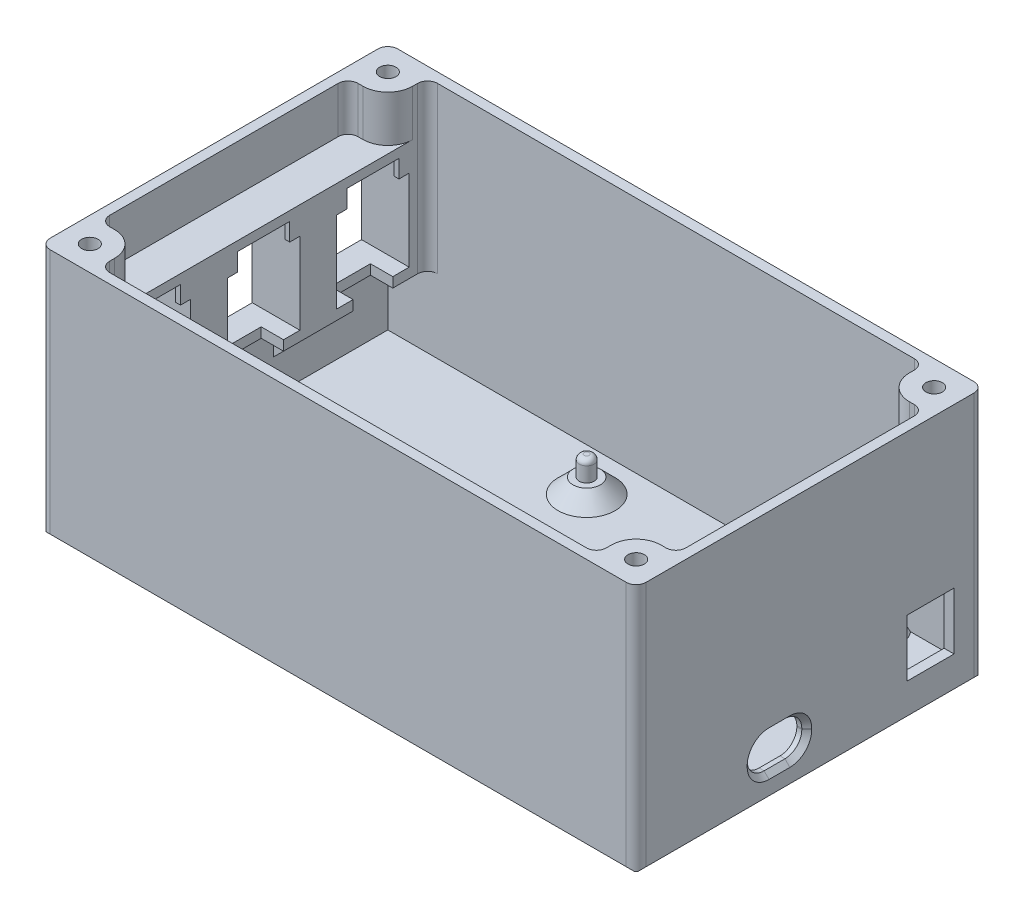
from build123d import *

# Parameters (mm, degrees)
SKETCH1_W                                  = 120
SKETCH1_H                                  = 70
BOSS_EXTRUDE1_DEPTH                        = 50
SHELL1_T                                   = -2
SKETCH16_W                                 = 9.5
SKETCH16_H                                 = 11.5
CUT_EXTRUDE9_DEPTH                         = 2
CHAMFER2_SIZE                              = 1
CHAMFER3_SIZE                              = 0.4
SKETCH17_R                                 = 2.75
BOSS_EXTRUDE7_DEPTH                        = 3
SKETCH18_R                                 = 1.5
BOSS_EXTRUDE8_DEPTH                        = 4
CHAMFER4_SIZE                              = 3
FILLET1_R                                  = 1
CUT_EXTRUDE1_REACH                         = 134.758
SKETCH5_2_W                                = 14.6
SKETCH5_2_H                                = 16.4
CUT_EXTRUDE1_DIRECTION_2_DEPTH             = 10
SKETCH6_W                                  = 18.6
SKETCH6_H                                  = 23.9
BOSS_EXTRUDE5_DEPTH                        = 8
CUT_EXTRUDE2_REACH                         = 134.758
SKETCH5_2_2_W                              = 14.6
SKETCH5_2_2_H                              = 16.4
SKETCH12_W                                 = 14.6
SKETCH12_H                                 = 4.5
CUT_EXTRUDE7_DEPTH                         = 4.5
BOSS_EXTRUDE6_DEPTH                        = 1
CHAMFER1_SIZE                              = 0.4
SKETCH14_W                                 = 8
SKETCH14_H                                 = 2
CUT_EXTRUDE8_DEPTH                         = 4.5
LPATTERN3_COUNT                            = 3
LPATTERN3_PITCH                            = 22
CHAMFER1_OF_LPATTERN3_SIZE                 = 0.4
SKETCH19_W                                 = 66
SKETCH19_H                                 = 12
CUT_EXTRUDE10_DEPTH                        = 0.4
SKETCH20_R                                 = 1.65
BOSS_EXTRUDE9_DEPTH                        = 9.3
MIRROR1_AT_THE_SECOND_PLANE_COPY_1_SKETC_R = 1.65
MIRROR1_AT_THE_SECOND_PLANE_COPY_1_DEPTH   = 9.3
SKETCH21_W                                 = 8
SKETCH21_H                                 = 23.9
BOSS_EXTRUDE10_DEPTH                       = 3.4
SKETCH22_W                                 = 8
SKETCH22_H                                 = 23.9
BOSS_EXTRUDE11_DEPTH                       = 3.4
BOSS_EXTRUDE12_REACH                       = 104.448
SKETCH23_W                                 = 8
SKETCH23_H                                 = 23.9
BOSS_EXTRUDE13_REACH                       = 104.448
SKETCH24_W                                 = 8
SKETCH24_H                                 = 23.9
RIB1_REACH                                 = 92.642
SKETCH25_WALL_W                            = 11.313708498
SKETCH25_WALL_H                            = 2
FILLET2_R                                  = 2


with BuildPart() as part:
    # Sketch1 → Boss-Extrude1 (new body)
    with BuildSketch(Plane(origin=(0, 0, 0), x_dir=(1, 0, 0), z_dir=(0, 1, 0))):
        Rectangle(SKETCH1_W, SKETCH1_H)
    extrude(amount=BOSS_EXTRUDE1_DEPTH)

    # Shell1
    shell1_openings = [part.faces().sort_by_distance(p)[0] for p in [
        (0, 50, 0),
    ]]
    offset(amount=SHELL1_T, openings=shell1_openings, kind=Kind.INTERSECTION)

    # Sketch16 → Cut-Extrude9 (cut)
    with BuildSketch(Plane(origin=(60, 0, 0), x_dir=(0, 0, -1), z_dir=(1, 0, 0))):
        with Locations((24.25, 12.25)):
            Rectangle(SKETCH16_W, SKETCH16_H)
        with BuildLine():
            Line((-8.25, 11.25), (-4.05, 11.25))
            ThreePointArc((-4.05, 11.25), (-1.645836944, 10.254163056), (-0.65, 7.85))
            Line((-0.65, 7.85), (-0.65, 7.65))
            ThreePointArc((-0.65, 7.65), (-1.645836944, 5.245836944), (-4.05, 4.25))
            Line((-4.05, 4.25), (-8.25, 4.25))
            ThreePointArc((-8.25, 4.25), (-10.654163056, 5.245836944), (-11.65, 7.65))
            Line((-11.65, 7.65), (-11.65, 7.85))
            ThreePointArc((-11.65, 7.85), (-10.654163056, 10.254163056), (-8.25, 11.25))
        make_face()
    extrude(amount=-CUT_EXTRUDE9_DEPTH, mode=Mode.SUBTRACT)

    # Chamfer2
    chamfer2_edges = [part.edges().sort_by_distance(p)[0] for p in [
        (60, 10.254163056, 1.645836944),
        (60, 11.25, 6.15),
        (60, 10.254163056, 10.654163056),
        (60, 7.75, 11.65),
        (60, 5.245836944, 10.654163056),
        (60, 4.25, 6.15),
        (60, 5.245836944, 1.645836944),
        (60, 7.75, 0.65),
    ]]
    chamfer(chamfer2_edges, length=CHAMFER2_SIZE)

    # Chamfer3
    chamfer3_edges = [part.edges().sort_by_distance(p)[0] for p in [
        (0, 0, 35),
        (-60, 0, 0),
        (0, 0, -35),
        (60, 0, 0),
    ]]
    chamfer(chamfer3_edges, length=CHAMFER3_SIZE)

    # Sketch17 → Boss-Extrude7 (add)
    with BuildSketch(Plane(origin=(0, 2, 0), x_dir=(1, 0, 0), z_dir=(0, 1, 0))):
        with Locations(Location((-9.343316542, 24.38, 0), (0, 0, 90))):
            Circle(SKETCH17_R)
        with Locations(Location((42.726683458, 29.46, 0), (0, 0, 90))):
            Circle(SKETCH17_R)
        with Locations(Location((41.456683458, -18.8, 0), (0, 0, 90))):
            Circle(SKETCH17_R)
        with Locations(Location((-9.343316542, -3.56, 0), (0, 0, 90))):
            Circle(SKETCH17_R)
    extrude(amount=BOSS_EXTRUDE7_DEPTH)

    # Sketch18 → Boss-Extrude8 (add)
    with BuildSketch(Plane(origin=(0, 5, 0), x_dir=(1, 0, 0), z_dir=(0, 1, 0))):
        with Locations(Location((-9.343316542, 24.38, 0), (0, 0, 270))):
            Circle(SKETCH18_R)
        with Locations(Location((-9.343316542, -3.56, 0), (0, 0, 270))):
            Circle(SKETCH18_R)
        with Locations(Location((41.456683458, -18.8, 0), (0, 0, 270))):
            Circle(SKETCH18_R)
        with Locations(Location((42.726683458, 29.46, 0), (0, 0, 270))):
            Circle(SKETCH18_R)
    extrude(amount=BOSS_EXTRUDE8_DEPTH)

    # Chamfer4
    # the kernel refuses this chamfer: 3 mm, written as the material it adds along each edge
    with BuildSketch(Plane(origin=(-9.343316542, 2, -24.38), x_dir=(0, 0, -1), z_dir=(1, 0, 0))) as chamfer4_piece_1:
        Polygon((2.75 + CHAMFER4_SIZE, 0), (2.75, CHAMFER4_SIZE), (2.75, 0), align=None)
    revolve(axis=Axis((-9.343316542, 2, -24.38), (0, 1, 0)))
    with BuildSketch(Plane(origin=(42.726683458, 2, -29.46), x_dir=(0, 0, -1), z_dir=(1, 0, 0))) as chamfer4_piece_2_section:
        Polygon((2.75 + CHAMFER4_SIZE, 0), (2.75, CHAMFER4_SIZE), (2.75, 0), align=None)
    chamfer4_piece_2 = revolve(axis=Axis((42.726683458, 2, -29.46), (0, 1, 0)), mode=Mode.PRIVATE)
    chamfer4_piece_2 = split(chamfer4_piece_2, bisect_by=Plane(origin=(42.726683458, 3.467822067, -33), z_dir=(0, 0, 1)), keep=Keep.TOP, mode=Mode.PRIVATE)
    add(chamfer4_piece_2)
    with BuildSketch(Plane(origin=(41.456683458, 2, 18.8), x_dir=(0, 0, -1), z_dir=(1, 0, 0))) as chamfer4_piece_3:
        Polygon((2.75 + CHAMFER4_SIZE, 0), (2.75, CHAMFER4_SIZE), (2.75, 0), align=None)
    revolve(axis=Axis((41.456683458, 2, 18.8), (0, 1, 0)))
    with BuildSketch(Plane(origin=(-9.343316542, 2, 3.56), x_dir=(0, 0, -1), z_dir=(1, 0, 0))) as chamfer4_piece_4:
        Polygon((2.75 + CHAMFER4_SIZE, 0), (2.75, CHAMFER4_SIZE), (2.75, 0), align=None)
    revolve(axis=Axis((-9.343316542, 2, 3.56), (0, 1, 0)))

    # Fillet1
    fillet1_edges = [part.edges().sort_by_distance(p)[0] for p in [
        (-9.343316542, 9, -25.88),
        (-9.343316542, 9, 2.06),
        (41.456683458, 9, 17.3),
        (42.726683458, 9, -30.96),
    ]]
    fillet(fillet1_edges, radius=FILLET1_R)

    # Sketch5<2> → Cut-Extrude1 (cut, up to next)
    with BuildSketch(Plane(origin=(-58, 2.134792976, 2.546396695), x_dir=(0, 0, -1), z_dir=(1, 0, 0)), mode=Mode.PRIVATE) as cut_extrude1_sk1:
        with Locations((-19.453603305, 24.865207024)):
            Rectangle(SKETCH5_2_W, SKETCH5_2_H)
    cut_extrude1_tool1 = extrude(cut_extrude1_sk1.sketch, amount=-CUT_EXTRUDE1_REACH, mode=Mode.PRIVATE) & part.part
    cut_extrude1 = cut_extrude1_tool1.solids().sort_by_distance((-58, 27, 22))[0]
    add(cut_extrude1, mode=Mode.SUBTRACT)

    # Sketch5<2> → Cut-Extrude1 direction 2 (cut)
    with BuildSketch(Plane(origin=(-58, 2.134792976, 2.546396695), x_dir=(0, 0, -1), z_dir=(1, 0, 0))):
        with Locations((-19.453603305, 24.865207024)):
            Rectangle(SKETCH5_2_W, SKETCH5_2_H)
    cut_extrude1_direction_2 = extrude(amount=CUT_EXTRUDE1_DIRECTION_2_DEPTH, mode=Mode.SUBTRACT)

    # Sketch6 → Boss-Extrude5 (add)
    with BuildSketch(Plane(origin=(-58, 11, -1), x_dir=(0, 0, -1), z_dir=(1, 0, 0))):
        with Locations((-23, 17.75)):
            Rectangle(SKETCH6_W, SKETCH6_H)
    boss_extrude5 = extrude(amount=BOSS_EXTRUDE5_DEPTH)

    # Sketch5<2><2> → Cut-Extrude2 (cut, up to next)
    with BuildSketch(Plane(origin=(-58, 2.134792976, 2.546396695), x_dir=(0, 0, -1), z_dir=(1, 0, 0)), mode=Mode.PRIVATE) as cut_extrude2_sk1:
        with Locations((-19.453603305, 24.865207024)):
            Rectangle(SKETCH5_2_2_W, SKETCH5_2_2_H)
    cut_extrude2_tool1 = extrude(cut_extrude2_sk1.sketch, amount=CUT_EXTRUDE2_REACH, mode=Mode.PRIVATE) & part.part
    cut_extrude2 = cut_extrude2_tool1.solids().sort_by_distance((-58, 27, 22))[0]
    add(cut_extrude2, mode=Mode.SUBTRACT)

    # Sketch12 → Cut-Extrude7 (cut)
    with BuildSketch(Plane(origin=(-50, 6.567396488, 0.773198348), x_dir=(0, 0, -1), z_dir=(1, 0, 0))):
        with Locations((-21.226801652, 30.882603512)):
            Rectangle(SKETCH12_W, SKETCH12_H)
    cut_extrude7 = extrude(amount=-CUT_EXTRUDE7_DEPTH, mode=Mode.SUBTRACT)

    # Sketch13 → Boss-Extrude6 (add)
    with BuildSketch(Plane(origin=(-50, 6.567396488, 0.773198348), x_dir=(0, 0, -1), z_dir=(1, 0, 0))):
        Polygon((-13.926801652, 33.132603512), (-28.526801652, 33.132603512), (-28.526801652, 28.632603512), (-26.476801652, 28.632603512), (-26.476801652, 32.232603512), (-15.976801652, 32.232603512), (-15.976801652, 28.632603512), (-13.926801652, 28.632603512), align=None)
    boss_extrude6 = extrude(amount=-BOSS_EXTRUDE6_DEPTH)

    # Chamfer1
    chamfer1_edges = [part.edges().sort_by_distance(p)[0] for p in [
        (-60, 18.8, 22),
        (-60, 27, 29.3),
        (-60, 35.2, 22),
        (-60, 27, 14.7),
    ]]
    chamfer(chamfer1_edges, length=CHAMFER1_SIZE)

    # Sketch14 → Cut-Extrude8 (cut)
    with BuildSketch(Plane(origin=(-50, 6.567396488, 0.773198348), x_dir=(0, 0, -1), z_dir=(1, 0, 0))):
        with Locations((-21.226801652, 11.232603512)):
            Rectangle(SKETCH14_W, SKETCH14_H)
    cut_extrude8 = extrude(amount=-CUT_EXTRUDE8_DEPTH, mode=Mode.SUBTRACT)

    # LPattern3: Cut-Extrude1, Cut-Extrude1 direction 2, Boss-Extrude5, Cut-Extrude2, Cut-Extrude7, Boss-Extrude6, Cut-Extrude8 ×3
    with Locations(*[(0, 0, -i * LPATTERN3_PITCH) for i in range(1, LPATTERN3_COUNT)]):
        add(cut_extrude1, mode=Mode.SUBTRACT)
        add(cut_extrude1_direction_2, mode=Mode.SUBTRACT)
        add(boss_extrude5)
        add(cut_extrude2, mode=Mode.SUBTRACT)
        add(cut_extrude7, mode=Mode.SUBTRACT)
        add(boss_extrude6)
        add(cut_extrude8, mode=Mode.SUBTRACT)

    # Chamfer1 of LPattern3
    chamfer1_of_lpattern3_edges = [part.edges().sort_by_distance(p)[0] for p in [
        (-60, 18.8, 0),
        (-60, 27, 7.3),
        (-60, 35.2, 0),
        (-60, 27, -7.3),
        (-60, 18.8, -22),
        (-60, 27, -14.7),
        (-60, 35.2, -22),
        (-60, 27, -29.3),
    ]]
    chamfer(chamfer1_of_lpattern3_edges, length=CHAMFER1_OF_LPATTERN3_SIZE)

    # Sketch19 → Cut-Extrude10 (cut)
    with BuildSketch(Plane.ZY.offset(60)):
        with Locations((0, 9.4)):
            Rectangle(SKETCH19_W, SKETCH19_H)
    extrude(amount=-CUT_EXTRUDE10_DEPTH, mode=Mode.SUBTRACT)

    # Sketch20 → Boss-Extrude9 (add)
    with BuildSketch(Plane(origin=(0, 50, 0), x_dir=(1, 0, 0), z_dir=(0, 1, 0))):
        with BuildLine():
            Line((58, 33), (50, 33))
            Line((50, 33), (50, 30))
            ThreePointArc((50, 30), (51.464466094, 26.464466094), (55, 25))
            Line((55, 25), (58, 25))
            Line((58, 25), (58, 33))
        make_face()
        with Locations(Location((55, 30, 0), (0, 0, 270))):
            Circle(SKETCH20_R, mode=Mode.SUBTRACT)
    boss_extrude9 = extrude(amount=-BOSS_EXTRUDE9_DEPTH)

    # Mirror1: Boss-Extrude9 across plane
    add(boss_extrude9.mirror(Plane.XY))

    # Mirror1 at the second plane: Boss-Extrude9 across plane
    add(boss_extrude9.mirror(Plane(origin=(0, 0, 0), x_dir=(0, 0, 1), z_dir=(1, 0, 0))))

    # Mirror1 at the second plane copy 1 sketc → Mirror1 at the second plane copy 1 (add)
    with BuildSketch(Plane(origin=(0, 50, 0), x_dir=(-1, 0, 0), z_dir=(0, 1, 0))):
        with BuildLine():
            Line((58, 33), (50, 33))
            Line((50, 33), (50, 30))
            ThreePointArc((50, 30), (51.464466094, 26.464466094), (55, 25))
            Line((55, 25), (58, 25))
            Line((58, 25), (58, 33))
        make_face()
        with Locations(Location((55, 30, 0), (0, 0, 270))):
            Circle(MIRROR1_AT_THE_SECOND_PLANE_COPY_1_SKETC_R, mode=Mode.SUBTRACT)
    extrude(amount=-MIRROR1_AT_THE_SECOND_PLANE_COPY_1_DEPTH)

    # Sketch21 → Boss-Extrude10 (add)
    with BuildSketch(Plane(origin=(0, 0, 12.7), x_dir=(-1, 0, 0), z_dir=(0, 0, -1))):
        with Locations((54, 28.75)):
            Rectangle(SKETCH21_W, SKETCH21_H)
    extrude(amount=BOSS_EXTRUDE10_DEPTH)

    # Sketch22 → Boss-Extrude11 (add)
    with BuildSketch(Plane(origin=(0, 0, -9.3), x_dir=(-1, 0, 0), z_dir=(0, 0, -1))):
        with Locations((54, 28.75)):
            Rectangle(SKETCH22_W, SKETCH22_H)
    extrude(amount=BOSS_EXTRUDE11_DEPTH)

    # Sketch23 → Boss-Extrude12 (add, up to next)
    with BuildSketch(Plane.XY.offset(31.3), mode=Mode.PRIVATE) as boss_extrude12_sk1:
        with Locations((-54, 28.75)):
            Rectangle(SKETCH23_W, SKETCH23_H)
    boss_extrude12_tool1 = extrude(boss_extrude12_sk1.sketch, amount=BOSS_EXTRUDE12_REACH, mode=Mode.PRIVATE) - part.part
    add(boss_extrude12_tool1.solids().sort_by_distance((-54, 28.75, 31.3))[0])

    # Sketch24 → Boss-Extrude13 (add, up to next)
    with BuildSketch(Plane(origin=(0, 0, -31.3), x_dir=(-1, 0, 0), z_dir=(0, 0, -1)), mode=Mode.PRIVATE) as boss_extrude13_sk1:
        with Locations((54, 28.75)):
            Rectangle(SKETCH24_W, SKETCH24_H)
    boss_extrude13_tool1 = extrude(boss_extrude13_sk1.sketch, amount=BOSS_EXTRUDE13_REACH, mode=Mode.PRIVATE) - part.part
    add(boss_extrude13_tool1.solids().sort_by_distance((-54, 28.75, -31.3))[0])

    # Sketch25 wall → Rib1 (add, up to next)
    with BuildSketch(Plane(origin=(-54, 12.8, 11), x_dir=(-0.707106781187, -0.707106781187, 0), z_dir=(0.707106781187, -0.707106781187, 0)), mode=Mode.PRIVATE) as rib1_sk1:
        Rectangle(SKETCH25_WALL_W, SKETCH25_WALL_H)
    rib1_tool1 = extrude(rib1_sk1.sketch, amount=-RIB1_REACH, mode=Mode.PRIVATE) - part.part
    rib1 = rib1_tool1.solids().sort_by_distance((-54, 12.8, 11))[0]
    add(rib1)

    # Mirror2: Rib1 across plane
    add(rib1.mirror(Plane.XY))

    # Fillet2
    # the kernel refuses this fillet: 2 mm, written as the material it adds along each edge
    with BuildSketch(Plane(origin=(58, 50, -25), x_dir=(-1, 0, 0), z_dir=(0, -1, 0)), Plane(origin=(50, 50, -33), x_dir=(-1, 0, 0), z_dir=(0, -1, 0)), Plane(origin=(58, 50, 25), x_dir=(0, 0, -1), z_dir=(0, -1, 0))) as fillet2_piece_1:
        with BuildLine():
            CenterArc((FILLET2_R, -FILLET2_R), FILLET2_R, 90, 90)
            Line((0, -FILLET2_R), (0, 0))
            Line((0, 0), (FILLET2_R, 0))
        make_face()
    extrude(amount=9.3)
    with BuildSketch(Plane(origin=(-50, 16.8, -33), x_dir=(0, 0, 1), z_dir=(0, 1, 0)), Plane(origin=(-50, 16.8, 33), x_dir=(1, 0, 0), z_dir=(0, 1, 0))) as fillet2_piece_2:
        with BuildLine():
            CenterArc((FILLET2_R, FILLET2_R), FILLET2_R, 180, 90)
            Line((0, FILLET2_R), (0, 0))
            Line((0, 0), (FILLET2_R, 0))
        make_face()
    extrude(amount=33.2)
    with BuildSketch(Plane(origin=(-58, 50, -25), x_dir=(0, 0, 1), z_dir=(0, -1, 0)), Plane(origin=(-58, 50, 25), x_dir=(1, 0, 0), z_dir=(0, -1, 0))) as fillet2_piece_3:
        with BuildLine():
            CenterArc((FILLET2_R, -FILLET2_R), FILLET2_R, 90, 90)
            Line((0, -FILLET2_R), (0, 0))
            Line((0, 0), (FILLET2_R, 0))
        make_face()
    extrude(amount=14.3)
    with BuildSketch(Plane(origin=(50, 50, 33), x_dir=(-1, 0, 0), z_dir=(0, -1, 0))) as fillet2_piece_4:
        with BuildLine():
            CenterArc((FILLET2_R, FILLET2_R), FILLET2_R, 180, 90)
            Line((0, FILLET2_R), (0, 0))
            Line((0, 0), (FILLET2_R, 0))
        make_face()
    extrude(amount=9.3)
    # the kernel refuses this fillet: 2 mm, written as the material it takes off along each edge
    with BuildSketch(Plane(origin=(60, -4.6, 35), x_dir=(0, 0, -1), z_dir=(0, 1, 0)), Plane(origin=(-60, -4.6, -35), x_dir=(0, 0, 1), z_dir=(0, 1, 0))) as fillet2_2_piece_1:
        with BuildLine():
            CenterArc((FILLET2_R, FILLET2_R), FILLET2_R, 180, 90)
            Line((0, FILLET2_R), (0, 0))
            Line((0, 0), (FILLET2_R, 0))
        make_face()
    extrude(amount=59.6, mode=Mode.SUBTRACT)
    with BuildSketch(Plane(origin=(-60, -4.6, 35), x_dir=(0, 0, -1), z_dir=(0, 1, 0)), Plane(origin=(60, -4.6, -35), x_dir=(0, 0, 1), z_dir=(0, 1, 0))) as fillet2_2_piece_2:
        with BuildLine():
            CenterArc((FILLET2_R, -FILLET2_R), FILLET2_R, 90, 90)
            Line((0, -FILLET2_R), (0, 0))
            Line((0, 0), (FILLET2_R, 0))
        make_face()
    extrude(amount=59.6, mode=Mode.SUBTRACT)


solid = part.part
